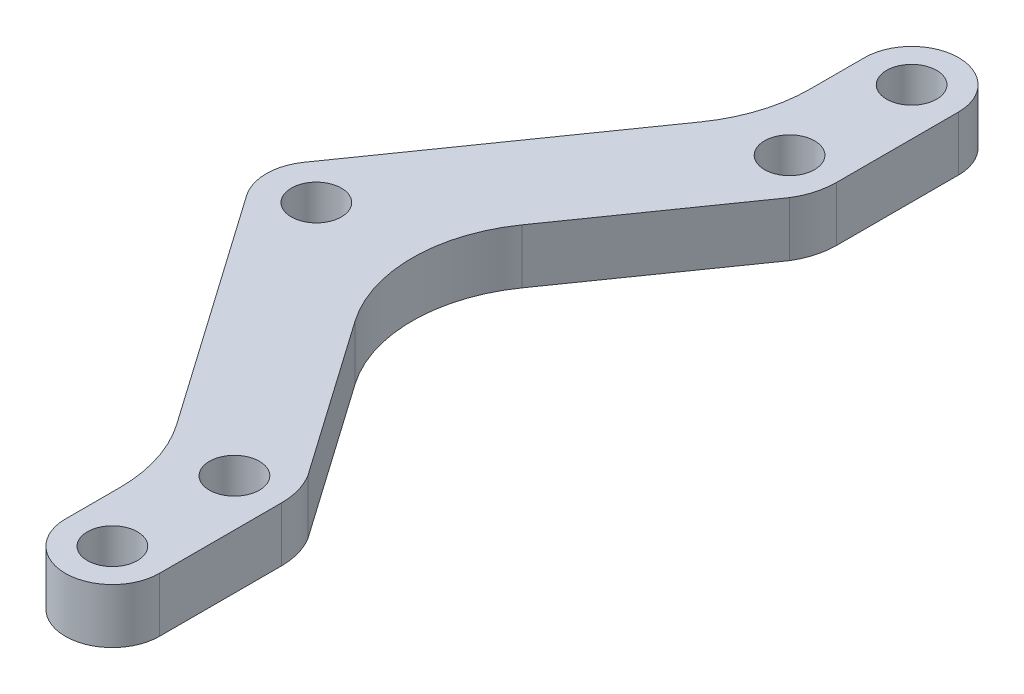
from build123d import *

# Parameters (mm, degrees)
BOSS_EXTRUDE1_DEPTH = 3
SKETCH3_R           = 1.375
CUT_EXTRUDE1_DEPTH  = 38.91792753
FILLET1_R           = 8


with BuildPart() as part:
    # Sketch2 → Boss-Extrude1 (new body)
    with BuildSketch(Plane(origin=(0, 0, 0), x_dir=(1, 0, 0), z_dir=(0, 1, 0))):
        with BuildLine():
            Line((-12.66542378, 21.955324516), (-12.66542378, 15.25))
            ThreePointArc((-12.66542378, 15.25), (-12.810144222, 14.202492305), (-13.233463188, 13.233463188))
            Line((-13.233463188, 13.233463188), (-22.5, 0))
            Line((-22.5, 0), (-24.625, 0))
            ThreePointArc((-24.625, 0), (-26, 1.375), (-27.375, 0))
            Line((-27.375, 0), (-28.75, 0))
            ThreePointArc((-28.75, 0), (-28.622713939, 0.826965294), (-28.252638839, 1.57737702))
            Line((-28.252638839, 1.57737702), (-17.83457622, 16.455324516))
            Line((-17.83457622, 16.455324516), (-17.83457622, 21.955324516))
            ThreePointArc((-17.83457622, 21.955324516), (-15.25, 24.539900736), (-12.66542378, 21.955324516))
        make_face()
    boss_extrude1 = extrude(amount=BOSS_EXTRUDE1_DEPTH)

    # Sketch3 → Cut-Extrude1 (cut, through all)
    with BuildSketch(Plane(origin=(0, 3, 0), x_dir=(1, 0, 0), z_dir=(0, 1, 0))):
        with Locations((-15.25, 15.25)):
            Circle(SKETCH3_R)
        with Locations((-15.25, 21.955324516)):
            Circle(SKETCH3_R)
    cut_extrude1 = extrude(amount=-CUT_EXTRUDE1_DEPTH, mode=Mode.SUBTRACT)

    # Mirror2: Boss-Extrude1, Cut-Extrude1 across plane
    add(boss_extrude1.mirror(Plane(origin=(-22.5, 3, 0), x_dir=(1, 0, 0), z_dir=(0, 0, -1))))
    add(cut_extrude1.mirror(Plane(origin=(-22.5, 3, 0), x_dir=(1, 0, 0), z_dir=(0, 0, -1))), mode=Mode.SUBTRACT)

    # Fillet1
    fillet1_edges = [part.edges().sort_by_distance(p)[0] for p in [
        (-22.5, 1.5, 0),
        (-17.83457622, 1.5, 16.455324516),
        (-17.83457622, 1.5, -16.455324516),
    ]]
    fillet(fillet1_edges, radius=FILLET1_R)


solid = part.part
